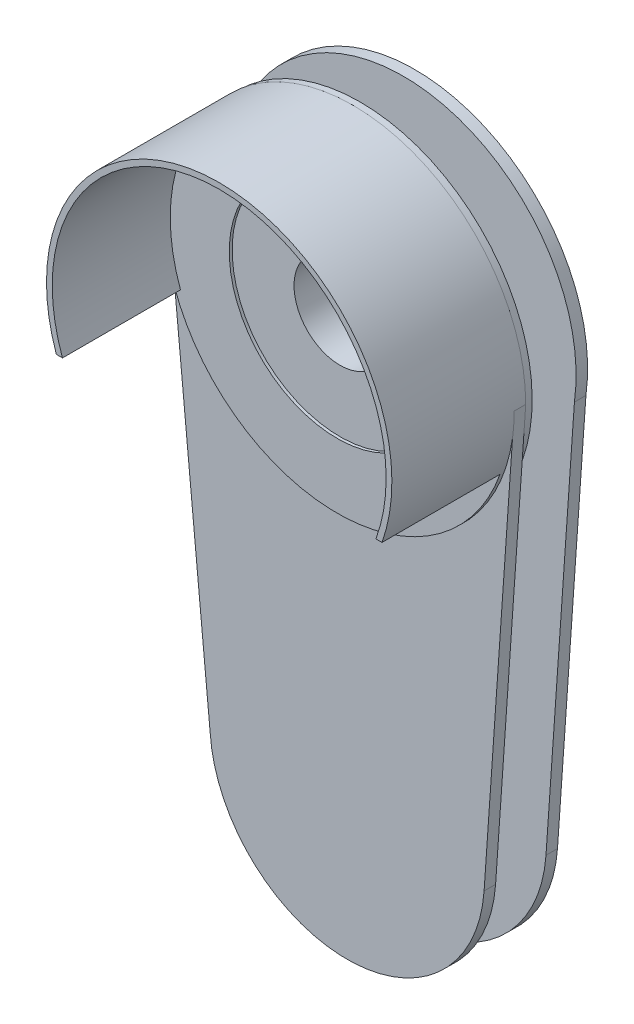
from build123d import *

# Parameters (mm, degrees)
SKETCH2_R               = 120
BOSS_EXTRUDE2_DEPTH     = 85
CUT_EXTRUDE1_START      = -82
CUT_EXTRUDE1_DEPTH      = 82
CUT_EXTRUDE5_DEPTH      = 2
CUT_EXTRUDE5_DEPTH_BACK = 2
SKETCH8_R               = 75
SKETCH9_R               = 32
CUT_EXTRUDE6_DEPTH      = 5
SKETCH12_R              = 32
BOSS_EXTRUDE4_DEPTH     = 8
SKETCH13_R              = 119.470235088
BOSS_EXTRUDE5_DEPTH     = 5
SKETCH15_R              = 70
BOSS_EXTRUDE6_DEPTH     = 30
SKETCH16_R              = 120
BOSS_EXTRUDE7_DEPTH     = 8
CUT_EXTRUDE7_START      = -210
SKETCH19_R              = 32
CUT_EXTRUDE7_DEPTH      = 210
BOSS_EXTRUDE8_START     = -8
BOSS_EXTRUDE8_DEPTH     = 8


with BuildPart() as part:
    # Sketch2 → Boss-Extrude2 (new body)
    with BuildSketch(Plane.XY):
        Circle(SKETCH2_R)
    extrude(amount=BOSS_EXTRUDE2_DEPTH)

    # Sketch3 → Cut-Extrude1 (cut)
    with BuildSketch(Plane.XY.offset(85).offset(CUT_EXTRUDE1_START)):
        with BuildLine():
            Line((-108.885260711, -40), (-113.13708499, -40))
            ThreePointArc((-113.13708499, -40), (0, -120), (113.13708499, -40))
            Line((113.13708499, -40), (108.885260711, -40))
            ThreePointArc((108.885260711, -40), (0, 116), (-108.885260711, -40))
        make_face()
    extrude(amount=CUT_EXTRUDE1_DEPTH, mode=Mode.SUBTRACT)

    # Sketch8 → Cut-Extrude5 (cut, two sides: drawn at the far end of the back side and taken through both)
    with BuildSketch(Plane.XY.offset(3).offset(-CUT_EXTRUDE5_DEPTH_BACK)):
        Circle(SKETCH8_R)
    extrude(amount=CUT_EXTRUDE5_DEPTH + CUT_EXTRUDE5_DEPTH_BACK, mode=Mode.SUBTRACT)

    # Sketch9 → Cut-Extrude6 (cut)
    with BuildSketch(Plane.XY.offset(1)):
        Circle(SKETCH9_R)
    extrude(amount=-CUT_EXTRUDE6_DEPTH, mode=Mode.SUBTRACT)

    # Sketch12 → Boss-Extrude4 (add)
    with BuildSketch(Plane(origin=(0, 0, 0), x_dir=(-1, 0, 0), z_dir=(0, 0, -1))):
        with BuildLine():
            ThreePointArc((120, 0), (0, 120), (-120, 0))
            Line((-120, 0), (-99.063378042, -299.268538041))
            ThreePointArc((-99.063378042, -299.268538041), (-3.575656086, -388.008129656), (91.309922092, -298.624981255))
            Line((91.309922092, -298.624981255), (120, 0))
        make_face()
        Circle(SKETCH12_R, mode=Mode.SUBTRACT)
    extrude(amount=BOSS_EXTRUDE4_DEPTH)

    # Sketch13 → Boss-Extrude5 (add)
    with BuildSketch(Plane(origin=(0, 0, -8), x_dir=(-1, 0, 0), z_dir=(0, 0, -1))):
        Circle(SKETCH13_R)
    extrude(amount=BOSS_EXTRUDE5_DEPTH)

    # Sketch15 → Boss-Extrude6 (add)
    with BuildSketch(Plane(origin=(0, 0, -13), x_dir=(-1, 0, 0), z_dir=(0, 0, -1))):
        Circle(SKETCH15_R)
    extrude(amount=BOSS_EXTRUDE6_DEPTH)

    # Sketch16 → Boss-Extrude7 (add)
    with BuildSketch(Plane(origin=(0, 0, -43), x_dir=(-1, 0, 0), z_dir=(0, 0, -1))):
        Circle(SKETCH16_R)
    extrude(amount=BOSS_EXTRUDE7_DEPTH)

    # Sketch19 → Cut-Extrude7 (cut)
    with BuildSketch(Plane(origin=(0, 0, -51), x_dir=(-1, 0, 0), z_dir=(0, 0, -1)).offset(CUT_EXTRUDE7_START)):
        Circle(SKETCH19_R)
    extrude(amount=CUT_EXTRUDE7_DEPTH, mode=Mode.SUBTRACT)

    # Sketch20 → Boss-Extrude8 (add)
    with BuildSketch(Plane(origin=(0, 0, -51), x_dir=(-1, 0, 0), z_dir=(0, 0, -1)).offset(BOSS_EXTRUDE8_START)):
        with BuildLine():
            ThreePointArc((117.805011812, -22.84686394), (-3.111785776, -119.959646504), (-118.831087629, -16.70845932))
            Line((-118.831087629, -16.70845932), (-99.063378042, -299.268538041))
            ThreePointArc((-99.063378042, -299.268538041), (-3.575656086, -388.008129656), (91.309922092, -298.624981255))
            Line((91.309922092, -298.624981255), (117.805011812, -22.84686394))
        make_face()
    extrude(amount=BOSS_EXTRUDE8_DEPTH)


solid = part.part
